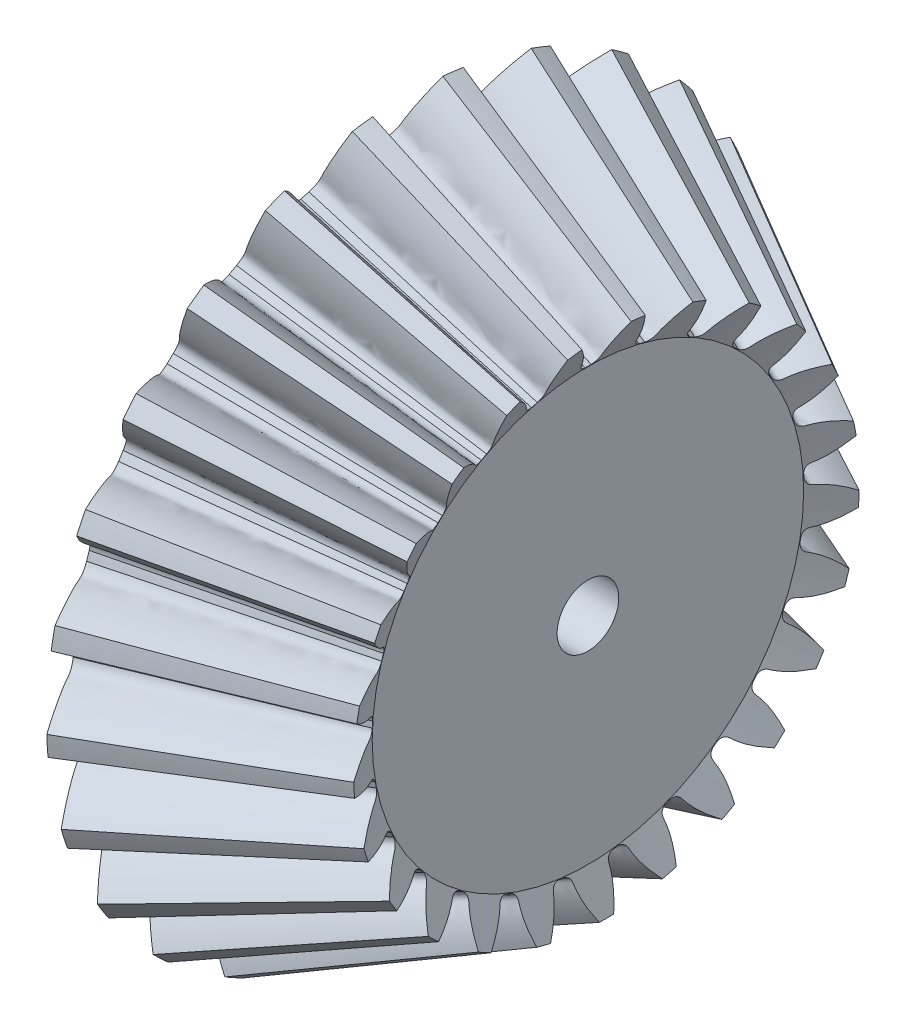
from build123d import *

# Parameters (mm, degrees)
PATTERN_CIRCULAR_1_COUNT = 25


# Read off the part's stored shape, not the designer's step: 旋转1
with BuildPart() as part:
    # 旋转1 outline → 旋转1 (revolve)
    with BuildSketch(Plane.YX):
        Polygon((1.142668737, 4.983720817), (9.967441634, 4.983720817), (13.394427191, 6.697213595), (9.376099034, 14.063049517), (7.99868116, 13.37434058), (1.142668737, 13.37434058), align=None)
    revolve(axis=Axis((0, 0, 0), (1, 0, 0)))

    # 草图6 → 切除-放样1 section 0
    with BuildSketch(Plane(origin=(0, 0, 0), x_dir=(0, 0, -1), z_dir=(0.8944271909999161, -0.4472135954999577, -1.0341155557737348e-13)), mode=Mode.PRIVATE) as loft_1_s0:
        with BuildLine():
            ThreePointArc((0.158630737, 12.799017005), (0, 12.8), (-0.158630737, 12.799017005))
            add(Edge.make_bspline(
                [(-0.158630737, 12.799017005), (-0.518698388, 12.871725776), (-0.523640487, 13.111824144), (-0.576996553, 13.358138373), (-0.588549211, 13.406979971), (-0.602402021, 13.460672171), (-0.618735232, 13.519147254), (-0.637750639, 13.582323362), (-0.659640511, 13.650115229), (-0.684596933, 13.722430958), (-0.712808763, 13.799173077), (-0.744462347, 13.880238313), (-0.779741103, 13.965517744), (-0.818825447, 14.054896852), (-0.861892623, 14.148255604), (-0.909116557, 14.245468539), (-0.960667713, 14.346404845), (-1.016712949, 14.450928453), (-1.077415371, 14.558898132), (-1.142934199, 14.670167578), (-1.213424628, 14.784585521), (-1.289037692, 14.901995824), (-1.369920133, 15.022237591), (-1.456214271, 15.145145276), (-1.548057879, 15.270548799), (-1.645584057, 15.398273659), (-1.748921111, 15.528141054), (-1.858192435, 15.659968006), (-1.973516397, 15.793567484), (-2.095006225, 15.928748535), (-2.222769898, 16.065316412), (-2.356910044, 16.203072712), (-2.497523828, 16.341815509), (-2.644702874, 16.481339498), (-2.79853311, 16.621436133), (-3.015256054, 16.811022938), (-3.184097534, 16.949907109), (-3.299795871, 17.041351078)],
                knots=[0, 0, 0, 0, 0.123221078, 0.131595468, 0.140950825, 0.151287149, 0.16260444, 0.174902697, 0.188181922, 0.202442113, 0.217683271, 0.233905396, 0.251108488, 0.269292546, 0.288457572, 0.308603564, 0.329730523, 0.351838449, 0.374927341, 0.398997201, 0.424048027, 0.45007982, 0.47709258, 0.505086307, 0.534061001, 0.564016661, 0.594953289, 0.626870883, 0.659769444, 0.693648972, 0.728509466, 0.764350928, 0.801173356, 0.838976751, 0.877761113, 0.917526442, 1, 1, 1, 1], degree=3))
            ThreePointArc((-3.299795871, 17.041351078), (0, 17.357888678), (3.299795871, 17.041351078))
            add(Edge.make_bspline(
                [(0.158630737, 12.799017005), (0.518698388, 12.871725776), (0.523640487, 13.111824144), (0.576996553, 13.358138373), (0.588549211, 13.406979971), (0.602402021, 13.460672171), (0.618735232, 13.519147254), (0.637750639, 13.582323362), (0.659640511, 13.650115229), (0.684596933, 13.722430958), (0.712808763, 13.799173077), (0.744462347, 13.880238313), (0.779741103, 13.965517744), (0.818825447, 14.054896852), (0.861892623, 14.148255604), (0.909116557, 14.245468539), (0.960667713, 14.346404845), (1.016712949, 14.450928453), (1.077415371, 14.558898132), (1.142934199, 14.670167578), (1.213424628, 14.784585521), (1.289037692, 14.901995824), (1.369920133, 15.022237591), (1.456214271, 15.145145276), (1.548057879, 15.270548799), (1.645584057, 15.398273659), (1.748921111, 15.528141054), (1.858192435, 15.659968006), (1.973516397, 15.793567484), (2.095006225, 15.928748535), (2.222769898, 16.065316412), (2.356910044, 16.203072712), (2.497523828, 16.341815509), (2.644702874, 16.481339498), (2.79853311, 16.621436133), (3.015256054, 16.811022938), (3.184097534, 16.949907109), (3.299795871, 17.041351078)],
                knots=[0, 0, 0, 0, 0.123221078, 0.131595468, 0.140950825, 0.151287149, 0.16260444, 0.174902697, 0.188181922, 0.202442113, 0.217683271, 0.233905396, 0.251108488, 0.269292546, 0.288457572, 0.308603564, 0.329730523, 0.351838449, 0.374927341, 0.398997201, 0.424048027, 0.45007982, 0.47709258, 0.505086307, 0.534061001, 0.564016661, 0.594953289, 0.626870883, 0.659769444, 0.693648972, 0.728509466, 0.764350928, 0.801173356, 0.838976751, 0.877761113, 0.917526442, 1, 1, 1, 1], degree=3))
        make_face()
    loft_1 = loft([loft_1_s0.sketch, Vertex(31.25, 0, 0)], mode=Mode.SUBTRACT)

    # 阵列(圆周)1: 切除-放样1 ×25 about axis
    pattern_circular_1_axis = Axis((44.300117179, 0, 0), (-1, 0, 0))
    for i in range(1, PATTERN_CIRCULAR_1_COUNT):
        add(loft_1.rotate(pattern_circular_1_axis, i * 360 / PATTERN_CIRCULAR_1_COUNT), mode=Mode.SUBTRACT)


solid = part.part
